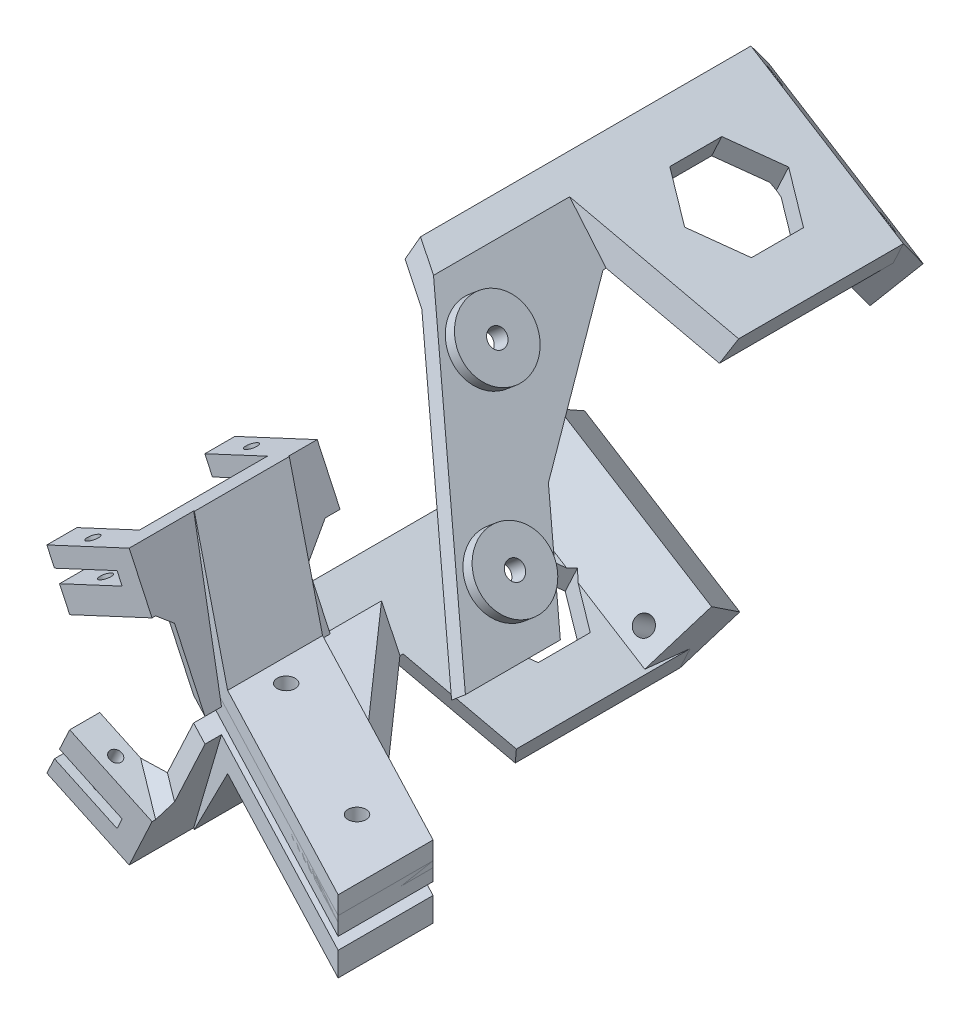
from build123d import *

# Parameters (mm, degrees)
BOSS_EXTRUDE1_DEPTH             = 3
SKETCH1_R                       = 6
BOSS_EXTRUDE3_DEPTH             = 2
SKETCH4_R                       = 1.5
CUT_EXTRUDE1_DEPTH              = 44.812962497
SKETCH5_R                       = 3.25
CUT_EXTRUDE2_DEPTH              = 2
SKETCH6_R                       = 1.5
BOSS_EXTRUDE4_DEPTH             = 4
CUT_EXTRUDE3_DEPTH              = 48.222467532
CUT_EXTRUDE3_DEPTH_BACK         = 48.222467532
SKETCH9_W                       = 15.125231148
SKETCH9_H                       = 5
SKETCH9_R                       = 1
BOSS_EXTRUDE6_DEPTH             = 4
SKETCH10_W                      = 3.625231148
SKETCH10_H                      = 31.3
BOSS_EXTRUDE7_DEPTH             = 2
SKETCH11_R                      = 1
BOSS_EXTRUDE8_DEPTH             = 3
CHAMFER2_SIZE                   = 4
CHAMFER3_SIZE                   = 2
CHAMFER4_SIZE                   = 4
CHAMFER4_SIZE_2                 = 20
BOSS_EXTRUDE9_DEPTH             = 52
BOSS_EXTRUDE9_DIRECTION_2_REACH = 51.204
SKETCH19_R                      = 3.25
CUT_EXTRUDE4_DEPTH              = 67.995097798
SKETCH20_R                      = 1.5
CUT_EXTRUDE5_DEPTH              = 67.995097798
BOSS_EXTRUDE10_DEPTH            = 27
BOSS_EXTRUDE12_DEPTH            = 4
BOSS_EXTRUDE11_DEPTH            = 31.65704896
BOSS_EXTRUDE11_START            = -16
BOSS_EXTRUDE11_2_OUTLINE_W      = 16
BOSS_EXTRUDE11_2_OUTLINE_H      = 16
BOSS_EXTRUDE11_2_DEPTH          = 1.93692213
SKETCH23_R                      = 1.5
CUT_EXTRUDE6_DEPTH              = 10
CHAMFER5_SIZE                   = 5
CHAMFER5_SIZE_2                 = 12
CHAMFER6_SIZE                   = 8
CHAMFER6_SIZE_2                 = 10.199591319
CUT_EXTRUDE7_DEPTH              = 76.916131799


with BuildPart() as part:
    # Sketch3 → Boss-Extrude1 (new body)
    with BuildSketch(Plane(origin=(0, 0, 0), x_dir=(1, 0, 0), z_dir=(0, 1, 0))):
        Polygon((-10, 13.145588768), (-10, -2.661376867), (34.799193535, -26.145588768), (34.799193535, -10.338623133), align=None)
    extrude(amount=BOSS_EXTRUDE1_DEPTH)

    # Sketch1 → Boss-Extrude3 (add)
    with BuildSketch(Plane(origin=(0, 0, 0), x_dir=(1, 0, 0), z_dir=(0, 1, 0))):
        with Locations(Location((0, 0, 0), (0, 0, 270))):
            Circle(SKETCH1_R)
        with Locations(Location((24.799193535, -13, 0), (0, 0, 270))):
            Circle(SKETCH1_R)
    extrude(amount=-BOSS_EXTRUDE3_DEPTH)

    # Sketch4 → Cut-Extrude1 (cut, through all)
    with BuildSketch(Plane(origin=(0, 3, 0), x_dir=(1, 0, 0), z_dir=(0, 1, 0))):
        with Locations(Location((0, 0, 0), (0, 0, 270))):
            Circle(SKETCH4_R)
        with Locations(Location((24.799193535, -13, 0), (0, 0, 270))):
            Circle(SKETCH4_R)
    extrude(amount=-CUT_EXTRUDE1_DEPTH, mode=Mode.SUBTRACT)

    # Sketch5 → Cut-Extrude2 (cut)
    with BuildSketch(Plane(origin=(0, 3, 0), x_dir=(1, 0, 0), z_dir=(0, 1, 0))):
        with Locations(Location((0, 0, 0), (0, 0, 270))):
            Circle(SKETCH5_R)
        with Locations(Location((24.799193535, -13, 0), (0, 0, 270))):
            Circle(SKETCH5_R)
    extrude(amount=-CUT_EXTRUDE2_DEPTH, mode=Mode.SUBTRACT)

    # Sketch18 → Boss-Extrude9 (add)
    with BuildSketch(Plane.XY):
        Polygon((-10, 0), (-14.531538935, 2.113091309), (-12.841065888, 5.738322457), (-0.535193667, 0), align=None)
    extrude(amount=-BOSS_EXTRUDE9_DEPTH)

    # Boss-Extrude9 direction 2: up to this plane
    boss_extrude9_direction_2_end = Plane(origin=(-10, 3, 2.661376867), z_dir=(0.4642857142857141, 0, -0.8856854834026605))
    # Sketch18 → Boss-Extrude9 direction 2 (add, up to the surface)
    with BuildSketch(Plane.XY, mode=Mode.PRIVATE) as boss_extrude9_direction_2_sk1:
        Polygon((-10, 0), (-14.531538935, 2.113091309), (-12.841065888, 5.738322457), (-0.535193667, 0), align=None)
    boss_extrude9_direction_2_tool1 = split(extrude(boss_extrude9_direction_2_sk1.sketch, amount=BOSS_EXTRUDE9_DIRECTION_2_REACH, mode=Mode.PRIVATE), bisect_by=boss_extrude9_direction_2_end, keep=Keep.BOTH, mode=Mode.PRIVATE)
    add(boss_extrude9_direction_2_tool1.solids().sort_by_distance((-9.047723, 2.102343, 0))[0])

    # Sketch19 → Cut-Extrude4 (cut, through all)
    with BuildSketch(Plane(origin=(0, 1, 0), x_dir=(1, 0, 0), z_dir=(0, 1, 0))):
        with Locations(Location((0, 0, 0), (0, 0, 270))):
            Circle(SKETCH19_R)
    extrude(amount=CUT_EXTRUDE4_DEPTH, mode=Mode.SUBTRACT)

    # Sketch20 → Cut-Extrude5 (cut, through all)
    with BuildSketch(Plane(origin=(0, 1, 0), x_dir=(1, 0, 0), z_dir=(0, 1, 0))):
        with Locations(Location((0, 0, 0), (0, 0, 90))):
            Circle(SKETCH20_R)
    extrude(amount=-CUT_EXTRUDE5_DEPTH, mode=Mode.SUBTRACT)

    # Sketch21 → Boss-Extrude10 (add, through all)
    with BuildSketch(Plane.XY.offset(-25)):
        Polygon((-0.535193667, 0), (15.25447551, -7.362843657), (13.564002463, -10.988074805), (-10, 0), align=None)
    extrude(amount=-BOSS_EXTRUDE10_DEPTH)

    # Sketch25 → Boss-Extrude12 (add)
    with BuildSketch(Plane(origin=(-1.786061952, -3.830222216, 0), x_dir=(0.9063077870366528, -0.4226182617406934, 0), z_dir=(-0.4226182617406934, -0.9063077870366528, 0))):
        Polygon((16.93692213, -52), (-14.06307787, -54.712148569), (-14.06307787, -52), align=None)
    extrude(amount=-BOSS_EXTRUDE12_DEPTH)

    # Boss-Extrude11: read off the stored shape, not the designer's step
    # Boss-Extrude11 outline → Boss-Extrude11 (add)
    with BuildSketch(Plane(origin=(19.457540688, -9.073200232, -103.802124301), x_dir=(-0.07898992833715975, 0.03683360850073174, 0.9961946980917462), z_dir=(-0.9028590122851758, 0.42101007166283105, -0.08715574274765152))):
        Polygon((45.843385247, 3.653924919), (52, -4.226182617), (52, -0.226182617), (59.027003215, -0.226182617), (52.147471276, 8.579216721), align=None)
    extrude(amount=BOSS_EXTRUDE11_DEPTH)

    # Boss-Extrude11 2 outline → Boss-Extrude11 2 (cut)
    with BuildSketch(Plane(origin=(0, 0, 0), x_dir=(0.42261826174069306, 0.9063077870366529, 0), z_dir=(0.906307787036653, -0.422618261740693, 0)).offset(BOSS_EXTRUDE11_START)):
        with Locations((2, -54)):
            Rectangle(BOSS_EXTRUDE11_2_OUTLINE_W, BOSS_EXTRUDE11_2_OUTLINE_H)
    extrude(amount=BOSS_EXTRUDE11_2_DEPTH, mode=Mode.SUBTRACT)

    # Sketch23 → Cut-Extrude6 (cut)
    with BuildSketch(Plane(origin=(-8.825520652, -26.172017209, -35.000355518), x_dir=(-0.9794918752400077, 0.08773549146275433, 0.18137847137023272), z_dir=(-0.19794486956653373, -0.5870040688588303, -0.7850121347823011))):
        with Locations(Location((-20.854864682, 24.981647096, 0), (0, 0, 92.198142173))):
            Circle(SKETCH23_R)
        with Locations(Location((-0.028999087, 34.742964743, 0), (0, 0, 92.198142173))):
            Circle(SKETCH23_R)
    extrude(amount=-CUT_EXTRUDE6_DEPTH, mode=Mode.SUBTRACT)

    # Chamfer5
    # the kernel refuses this chamfer: 12, 5 mm, written as the material it adds along each edge
    with BuildSketch(Plane(origin=(-41.111115995, 0, -25), x_dir=(0, 0, 1), z_dir=(1, 0, 0))) as chamfer5_piece_1_section:
        Polygon((CHAMFER5_SIZE, 0), (0, CHAMFER5_SIZE_2), (0, 0), align=None)
    chamfer5_piece_1 = extrude(amount=71.687038323, mode=Mode.PRIVATE)
    chamfer5_piece_1 = split(chamfer5_piece_1, bisect_by=Plane(origin=(-35.55447794, 11.916248764, -25), z_dir=(0.42261826174069345, 0.9063077870366528, 0)), keep=Keep.TOP, mode=Mode.PRIVATE)
    chamfer5_piece_1 = split(chamfer5_piece_1, bisect_by=Plane(origin=(-33.864004893, 15.541479912, -25), z_dir=(-0.4226182617406936, -0.9063077870366527, 0)), keep=Keep.TOP, mode=Mode.PRIVATE)
    chamfer5_piece_1 = split(chamfer5_piece_1, bisect_by=Plane(origin=(8.007364408, -22.904323569, -25), z_dir=(-0.9063077870366527, 0.42261826174069367, 0)), keep=Keep.TOP, mode=Mode.PRIVATE)
    add(chamfer5_piece_1)

    # Chamfer6
    # the kernel refuses this chamfer: 10.199591319, 8 mm, written as the material it adds along each edge
    with BuildSketch(Plane(origin=(-28.542352588, 13.059952688, -22.865686452), x_dir=(0.3380903670844996, 0.9242749779914557, 0.17723055251158748), z_dir=(0.8186169306793456, -0.381727343871112, 0.42912766835317584))) as chamfer6_piece_1_section:
        Polygon((CHAMFER6_SIZE, 0), (-CHAMFER6_SIZE_2 * 0.196215621528, -CHAMFER6_SIZE_2 * 0.98056077319), (0, 0), align=None)
    chamfer6_piece_1 = extrude(amount=60.566542446, mode=Mode.PRIVATE)
    chamfer6_piece_1 = split(chamfer6_piece_1, bisect_by=Plane(origin=(-28.542352588, 0, -22.865686452), z_dir=(0, 1, 0)), keep=Keep.TOP, mode=Mode.PRIVATE)
    chamfer6_piece_1 = split(chamfer6_piece_1, bisect_by=Plane(origin=(-28.542352588, 3, -22.865686452), z_dir=(0, -1, 0)), keep=Keep.TOP, mode=Mode.PRIVATE)
    add(chamfer6_piece_1)

    # Sketch24 → Cut-Extrude7 (cut, through all)
    with BuildSketch(Plane(origin=(-1.786061952, -3.830222216, 0), x_dir=(0.9063077870366528, -0.4226182617406934, 0), z_dir=(-0.4226182617406934, -0.9063077870366528, 0))):
        Polygon((1.43692213, -46.949436289), (8.93692213, -42.61930927), (8.93692213, -33.959055232), (1.43692213, -29.628928213), (-6.06307787, -33.959055232), (-6.06307787, -42.61930927), align=None)
    extrude(amount=-CUT_EXTRUDE7_DEPTH, mode=Mode.SUBTRACT)


with BuildPart() as body_2:
    # Sketch6 → Boss-Extrude4 (new body)
    with BuildSketch(Plane.XZ.offset(2)):
        Polygon((-10, 2.661376867), (-10, -13.145588768), (34.799193535, 10.338623133), (34.799193535, 26.145588768), align=None)
        with Locations(Location((0, 0, 0), (0, 0, 270))):
            Circle(SKETCH6_R, mode=Mode.SUBTRACT)
        with Locations(Location((24.799193535, 13, 0), (0, 0, 270))):
            Circle(SKETCH6_R, mode=Mode.SUBTRACT)
    extrude(amount=BOSS_EXTRUDE4_DEPTH)

    # Sketch16 → Loft1 section 0
    with BuildSketch(Plane(origin=(0, -18.313540167, 0), x_dir=(-1, 0, 0), z_dir=(0, -1, 0))):
        with BuildLine():
            Line((13.607128711, -7.50473643), (13.607128711, 13.79526357))
            Line((13.607128711, 13.79526357), (17.607128711, 15.892105951))
            Line((17.607128711, 15.892105951), (17.607128711, -5.407894049))
            Line((17.607128711, -5.407894049), (13.607128711, -7.50473643))
        make_face()
    # Sketch7 → Loft1 section 1
    with BuildSketch(Plane(origin=(0, -2, 0), x_dir=(1, 0, 0), z_dir=(0, 1, 0))):
        with BuildLine():
            Line((-10, 15.892105951), (-10, -5.407894049))
            Line((-10, -5.407894049), (-6, -7.50473643))
            Line((-6, -7.50473643), (-6, 13.79526357))
            Line((-6, 13.79526357), (-10, 15.892105951))
        make_face()
    loft()

    # Sketch17 → Cut-Extrude3 (cut, two sides: drawn at the far end of the back side and taken through both)
    with BuildSketch(Plane.XY.offset(-CUT_EXTRUDE3_DEPTH_BACK)):
        Polygon((-17.607128711, -18.313540167), (-13.607128711, -18.313540167), (-16.892703931, -16.78145128), align=None)
    extrude(amount=CUT_EXTRUDE3_DEPTH + CUT_EXTRUDE3_DEPTH_BACK, mode=Mode.SUBTRACT)

    # Sketch9 → Boss-Extrude6 (add)
    # profile 1 of 2: a face of its own
    with BuildSketch(Plane(origin=(-26.705419865, -12.205706693, 0), x_dir=(-0.9063077870366525, 0.42261826174069417, 0), z_dir=(0.4226182617406941, 0.9063077870366524, 0))):
        with Locations((-6.889749661, 7.907894049)):
            Rectangle(SKETCH9_W, SKETCH9_H)
        with Locations(Location((-5.077134087, 7.957894049, 0), (0, 0, 180))):
            Circle(SKETCH9_R, mode=Mode.SUBTRACT)
    # profile 2 of 2: a face of its own
    with BuildSketch(Plane(origin=(-26.705419865, -12.205706693, 0), x_dir=(-0.9063077870366525, 0.42261826174069417, 0), z_dir=(0.4226182617406941, 0.9063077870366524, 0))):
        Polygon((-10.827134087, -15.892105951), (0.672865913, -15.892105951), (0.672865913, -20.892105951), (-14.452365235, -20.892105951), (-14.452365235, -15.892105951), (-14.452365235, -13.79526357), align=None)
        with Locations(Location((-5.077134087, -18.442105951, 0), (0, 0, 180))):
            Circle(SKETCH9_R, mode=Mode.SUBTRACT)
    extrude(amount=BOSS_EXTRUDE6_DEPTH)

    # Sketch10 → Boss-Extrude7 (add)
    with BuildSketch(Plane(origin=(-50.114461272, -1.289891415, 0), x_dir=(-0.9063077870366525, 0.42261826174069417, 0), z_dir=(0.4226182617406941, 0.9063077870366524, 0))):
        with Locations((-38.468769054, -5.242105951)):
            Rectangle(SKETCH10_W, SKETCH10_H)
    extrude(amount=-BOSS_EXTRUDE7_DEPTH)

    # Sketch11 → Boss-Extrude8 (add)
    with BuildSketch(Plane(origin=(-10.290046849, -22.06707668, 0), x_dir=(0.9063077870366528, -0.4226182617406936, 0), z_dir=(-0.4226182617406936, -0.9063077870366528, 0))):
        Polygon((-19.717841347, 10.407894049), (-4.592610199, 10.407894049), (-4.592610199, -20.892105951), (-19.717841347, -20.892105951), (-19.717841347, -15.892105951), (-8.217841347, -15.892105951), (-8.217841347, 5.407894049), (-19.717841347, 5.407894049), align=None)
        with Locations((-13.967841347, -18.442105951)):
            Circle(SKETCH11_R, mode=Mode.SUBTRACT)
        with Locations((-13.967841347, 7.957894049)):
            Circle(SKETCH11_R, mode=Mode.SUBTRACT)
    extrude(amount=BOSS_EXTRUDE8_DEPTH)

    # Chamfer2
    # the kernel refuses this chamfer: 4 mm, written as the material it adds along each edge
    with BuildSketch(Plane(origin=(-3.8464274, -18.451518261, -8.644872691), x_dir=(0.4537728193833932, -0.2115977407410584, -0.8656307668412245), z_dir=(-0.7845279046867107, 0.36583136999170246, -0.5006829091329899))) as chamfer2_piece_1_section:
        Polygon((CHAMFER2_SIZE, 0), (0, -CHAMFER2_SIZE), (0, 0), align=None)
    chamfer2_piece_1 = extrude(amount=24.761428665, mode=Mode.PRIVATE)
    chamfer2_piece_1 = split(chamfer2_piece_1, bisect_by=Plane(origin=(-11.916655664, -14.688309019, -8.644872691), z_dir=(-0.9063077870366527, 0.4226182617406936, 0)), keep=Keep.TOP, mode=Mode.PRIVATE)
    chamfer2_piece_1 = split(chamfer2_piece_1, bisect_by=Plane(origin=(-15.202230884, -13.156220132, -8.644872691), z_dir=(0.9063077870366528, -0.4226182617406935, 0)), keep=Keep.TOP, mode=Mode.PRIVATE)
    add(chamfer2_piece_1)

    # Chamfer3
    # the kernel refuses this chamfer: 2 mm, written as the material it adds along each edge
    with BuildSketch(Plane(origin=(-7.881541532, -16.56991364, 10.079931869), x_dir=(0.42261826174069367, 0.9063077870366528, 0), z_dir=(-0.7845279046867109, 0.36583136999170235, -0.5006829091329895))) as chamfer3_piece_1_section:
        Polygon((CHAMFER3_SIZE, 0), (0, -CHAMFER3_SIZE), (0, 0), align=None)
    chamfer3_piece_1 = extrude(amount=14.474696714, mode=Mode.PRIVATE)
    chamfer3_piece_1 = split(chamfer3_piece_1, bisect_by=Plane(origin=(-11.916655664, -14.688309019, 10.079931869), z_dir=(-0.9063077870365974, 0.42261826174081224, 0)), keep=Keep.TOP, mode=Mode.PRIVATE)
    chamfer3_piece_1 = split(chamfer3_piece_1, bisect_by=Plane(origin=(-15.202230884, -13.156220132, 10.079931869), z_dir=(0.9063077870365974, -0.42261826174081224, 0)), keep=Keep.TOP, mode=Mode.PRIVATE)
    chamfer3_piece_1 = split(chamfer3_piece_1, bisect_by=Plane(origin=(-7.881541532, -16.56991364, 5.407894049), z_dir=(0, 0, 1)), keep=Keep.TOP, mode=Mode.PRIVATE)
    add(chamfer3_piece_1)
    with BuildSketch(Plane(origin=(-7.881541532, -16.56991364, 10.079931869), x_dir=(0.42261826174069367, 0.9063077870366528, 0), z_dir=(-0.7845279046867109, 0.36583136999170235, -0.5006829091329895))) as chamfer3_piece_2_section:
        Polygon((CHAMFER3_SIZE, 0), (0, -CHAMFER3_SIZE), (0, 0), align=None)
    chamfer3_piece_2 = extrude(amount=14.474696714, mode=Mode.PRIVATE)
    chamfer3_piece_2 = split(chamfer3_piece_2, bisect_by=Plane(origin=(-15.202230884, -13.156220132, 10.079931869), z_dir=(-0.9063077870365974, 0.42261826174081224, 0)), keep=Keep.TOP, mode=Mode.PRIVATE)
    chamfer3_piece_2 = split(chamfer3_piece_2, bisect_by=Plane(origin=(-7.881541532, -16.56991364, 5.407894049), z_dir=(0, 0, 1)), keep=Keep.TOP, mode=Mode.PRIVATE)
    add(chamfer3_piece_2)

    # Chamfer4
    # the kernel refuses this chamfer: 20, 4 mm, written as the material it adds along each edge
    with BuildSketch(Plane(origin=(-7.865230633, -6, -64.000203695), x_dir=(1, 0, 0), z_dir=(0, 0, 1))) as chamfer4_piece_1_section:
        Polygon((CHAMFER4_SIZE, 0), (-CHAMFER4_SIZE_2 * 0.422618261741, -CHAMFER4_SIZE_2 * 0.906307787037), (0, 0), align=None)
    chamfer4_piece_1 = extrude(amount=119.75433293, mode=Mode.PRIVATE)
    chamfer4_piece_1 = split(chamfer4_piece_1, bisect_by=Plane(origin=(-35.737387155, -6, -10.830434169), z_dir=(0.4642857142857141, 0, -0.8856854834026604)), keep=Keep.TOP, mode=Mode.PRIVATE)
    chamfer4_piece_1 = split(chamfer4_piece_1, bisect_by=Plane(origin=(-29.237387155, -6, -23.230030936), z_dir=(-0.4642857142857143, 0, 0.8856854834026603)), keep=Keep.TOP, mode=Mode.PRIVATE)
    chamfer4_piece_1 = split(chamfer4_piece_1, bisect_by=Plane(origin=(-15.72022002, -22.845079102, -64.000203695), z_dir=(0.4226182617406936, 0.9063077870366527, 0)), keep=Keep.TOP, mode=Mode.PRIVATE)
    add(chamfer4_piece_1)


with BuildPart() as body_3:
    # Mirror1: mirrored copy
    add(body_2.part.mirror(Plane.ZX))


with BuildPart() as body_4:
    # Mirror2: mirrored copy
    add(part.part.mirror(Plane(origin=(16.809141565, 36.047320414, 0), x_dir=(0, 0, 1), z_dir=(0.4226182617406937, 0.9063077870366527, 0))))


solid = Compound([part.part, body_2.part, body_3.part, body_4.part])
